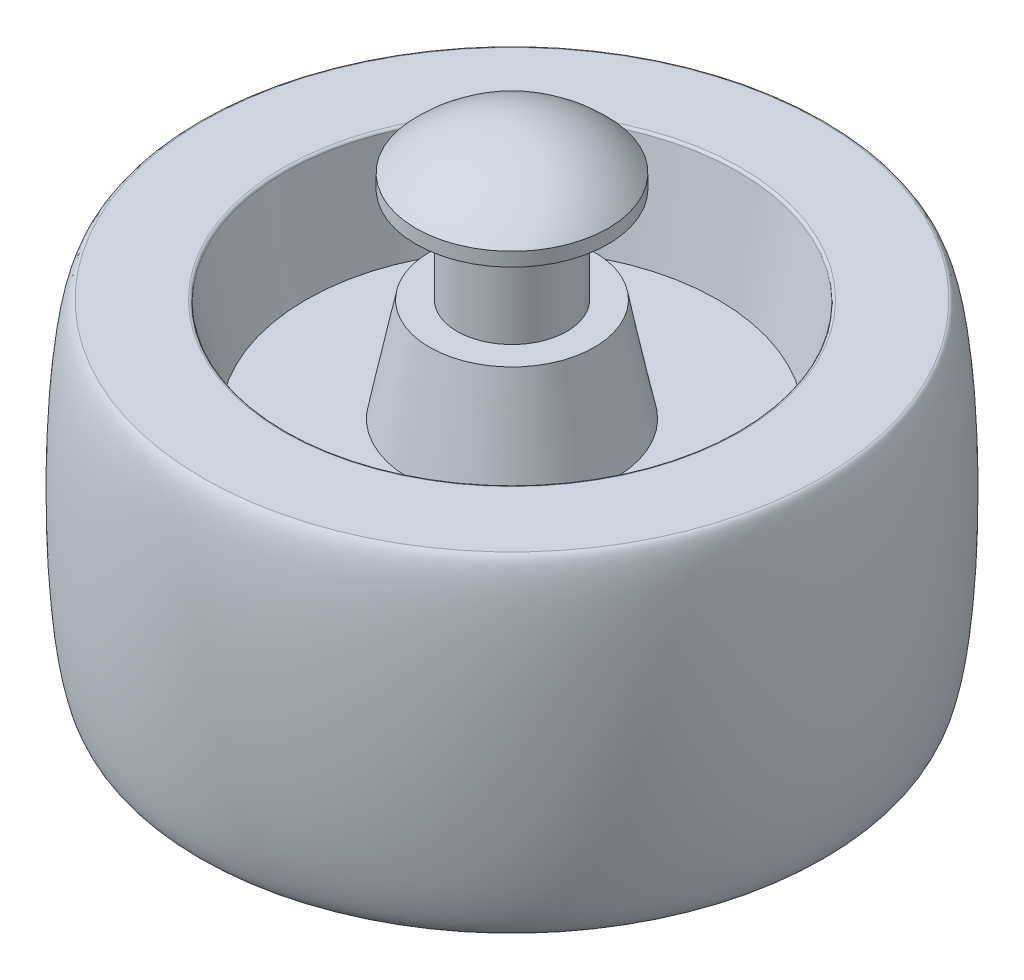
from build123d import *

# Parameters (mm, degrees)
CROQUIS2_R           = 2
EXTRUIR1_DEPTH       = 21.78461
EXTRUIR2_START       = -18.724201
EXTRUIR2_OUTLINE_R   = 2
EXTRUIR2_DEPTH       = 18.724201
EXTRUIR2_START_2     = -10
EXTRUIR2_2_OUTLINE_W = 7
EXTRUIR2_2_OUTLINE_H = 7
EXTRUIR2_2_DEPTH     = 0.851217
REDONDEO1_R          = 0.1
CROQUIS7_R           = 3.5
EXTRUIR3_DEPTH       = 0.5
CROQUIS9_R           = 3
CROQUIS9_R_2         = 1.5
EXTRUIR4_DEPTH       = 0.5
REDONDEO5_R          = 0.4


with BuildPart() as part:
    # Croquis1 → Revolución1 (revolve)
    with BuildSketch(Plane.XY, mode=Mode.PRIVATE) as revoluci_n1_sk:
        with BuildLine():
            Line((0, 6), (0, -6))
            Line((0, -6), (3, -6))
            Line((3, -6), (3.75, -2.25))
            Line((3.75, -2.25), (7.5, -2.25))
            Line((7.5, -2.25), (8.25, -6))
            Line((8.25, -6), (11.25, -6))
            add(Edge.make_bspline(
                [(11.25, -6), (12, -6), (12, 0), (12, 6), (11.25, 6)],
                knots=[3.141593, 3.141593, 3.141593, 4.712389, 4.712389, 6.283185, 6.283185, 6.283185], degree=2, weights=[1, 0.707107, 1, 0.707107, 1]))
            Line((11.25, 6), (8.25, 6))
            Line((8.25, 6), (7.5, 2.25))
            Line((7.5, 2.25), (3.75, 2.25))
            Line((3.75, 2.25), (3, 6))
            Line((3, 6), (0, 6))
        make_face()
    revolve(revoluci_n1_sk.sketch.rotate(Axis((0, 6, 0), (0, -1, 0)), 90), axis=Axis((0, 6, 0), (0, -1, 0)))

    # Croquis2 → Extruir1 (cut, through all)
    with BuildSketch(Plane(origin=(0, 6, 0), x_dir=(1, 0, 0), z_dir=(0, 1, 0))):
        with Locations(Location((0, 0, 0), (0, 0, 270))):
            Circle(CROQUIS2_R)
    extrude(amount=-EXTRUIR1_DEPTH, mode=Mode.SUBTRACT)

    # Extruir2: read off the stored shape, not the designer's step
    # Extruir2 outline → Extruir2 (add)
    with BuildSketch(Plane(origin=(0, 9.5, 0), x_dir=(-1, 0, 0), z_dir=(0, 1, 0)).offset(EXTRUIR2_START)):
        Circle(EXTRUIR2_OUTLINE_R)
    extrude(amount=EXTRUIR2_DEPTH)

    # Extruir2 2 outline → Extruir2 2 (cut)
    with BuildSketch(Plane(origin=(0, 0, 0), x_dir=(0.9999663238972207, -0.008202046727068174, -0.00027838995218587836), z_dir=(0.008206769856556707, 0.9993908270190958, 0.033920846077440184)).offset(EXTRUIR2_START_2)):
        with Locations((0.5, -0.5)):
            Rectangle(EXTRUIR2_2_OUTLINE_W, EXTRUIR2_2_OUTLINE_H)
    extrude(amount=EXTRUIR2_2_DEPTH, mode=Mode.SUBTRACT)

    # Redondeo1
    redondeo1_edges = [part.edges().sort_by_distance(p)[0] for p in [
        (0, -6, -8.25),
        (0, 6, -8.25),
    ]]
    fillet(redondeo1_edges, radius=REDONDEO1_R)

    # Croquis7 → Extruir3 (add)
    with BuildSketch(Plane(origin=(0, 9.5, 0), x_dir=(-1, 0, 0), z_dir=(0, 1, 0))):
        with Locations(Location((0, 0, 0), (0, 0, 90))):
            Circle(CROQUIS7_R)
    extrude(amount=EXTRUIR3_DEPTH)

    # Croquis8 → Revolución2 (revolve)
    with BuildSketch(Plane.XY, mode=Mode.PRIVATE) as revoluci_n2_sk:
        with BuildLine():
            Line((0, 10), (3.5, 10))
            ThreePointArc((3.5, 10), (1.903943, 11.109201), (0, 11.5))
            Line((0, 11.5), (0, 10))
        make_face()
    revolve(revoluci_n2_sk.sketch.rotate(Axis((0, 10, 0), (0, 1, 0)), 270), axis=Axis((0, 10, 0), (0, 1, 0)))

    # Croquis9 → Extruir4 (add)
    with BuildSketch(Plane(origin=(-0.075082, -9.14321, -0.310334), x_dir=(0.9999663137854952, -0.00820687074355578, -0.00013626021872642963), z_dir=(-0.00820676985655671, -0.9993908270190959, -0.033920846077440225))):
        with Locations(Location((0, 0, 0), (0, 0, 269.991852))):
            Circle(CROQUIS9_R)
        with Locations(Location((0, 0, 0), (0, 0, 269.991852))):
            Circle(CROQUIS9_R_2, mode=Mode.SUBTRACT)
    extrude(amount=EXTRUIR4_DEPTH)

    # Redondeo5
    redondeo5_edges = [part.edges().sort_by_distance(p)[0] for p in [
        (-0.079185, -9.744671, 2.670979),
        (-0.079185, -9.693788, 1.171842),
    ]]
    fillet(redondeo5_edges, radius=REDONDEO5_R)


solid = part.part
